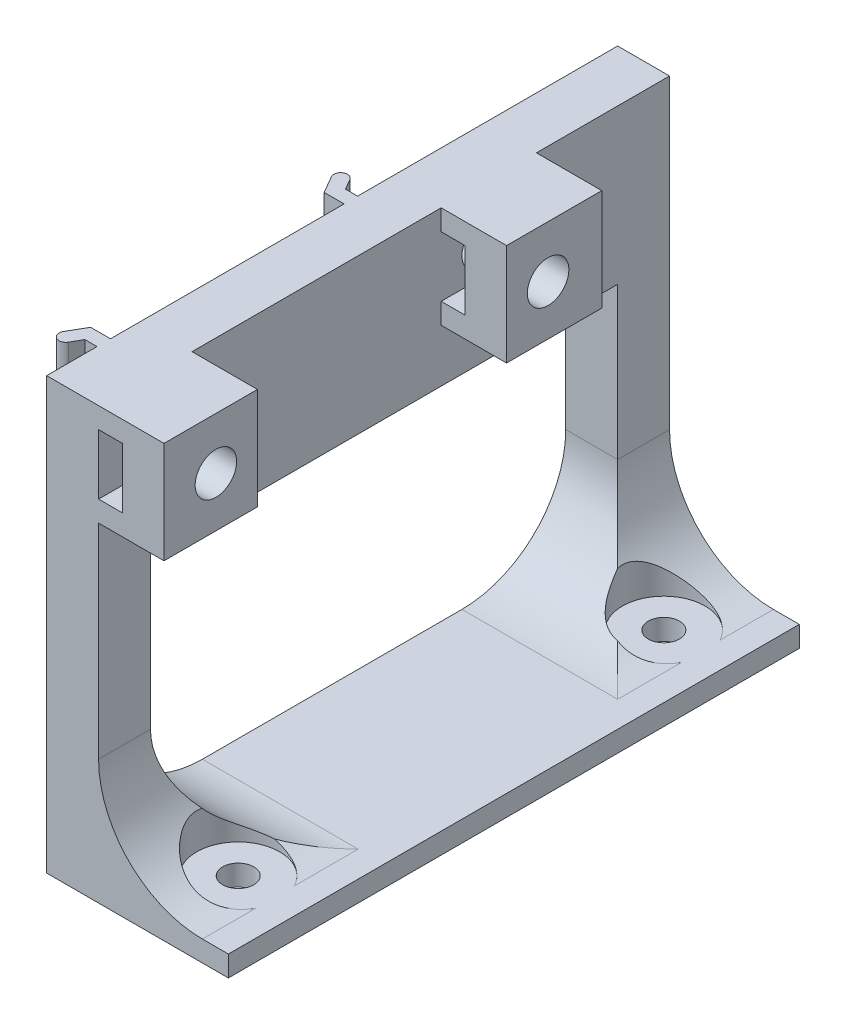
from build123d import *

# Parameters (mm, degrees)
SKETCH_1_W               = 17.5
SKETCH_1_H               = 55
EXTRUDE_1_DEPTH          = 2
SKETCH_2_W               = 5
SKETCH_2_H               = 5
EXTRUDE_2_DEPTH          = 33
EXTRUDE_3_DEPTH          = 6.5
EXTRUDE_3_DEPTH_BACK     = 8.378522314
SKETCH_3_W               = 5
SKETCH_3_H               = 55
SKETCH_4_R               = 1.5
CUT_EXTRUDE_1_DEPTH      = 10
FILLET_1_R               = 10
SKETCH_5_R               = 4
CUT_EXTRUDE_2_DEPTH      = 12
EXTRUDE_START            = -14.878522
EXTRUDE_4_DEPTH          = 14.878522
SKETCH_7_W               = 4
SKETCH_7_H               = 2
SKETCH_7_W_2             = 2.3
SKETCH_7_H_2             = 5.8
EXTRUDE_5_DEPTH          = 42.173435595
SKETCH_9_R               = 2
CUT_EXTRUDE_15_DEPTH     = 39
CUT_EXTRUDE_START        = -6.3
CUT_EXTRUDE_16_OUTLINE_W = 24
CUT_EXTRUDE_16_OUTLINE_H = 9.8
CUT_EXTRUDE_16_DEPTH     = 6.3


# Read off the part's stored shape, not the designer's step: Вырез-Вытянуть16
with BuildPart() as part:
    # Эскиз1 → Бобышка-Вытянуть1 (new body)
    with BuildSketch(Plane(origin=(0, 0, 0), x_dir=(1, 0, 0), z_dir=(0, 1, 0))):
        with Locations((8.75, 27.5)):
            Rectangle(SKETCH_1_W, SKETCH_1_H)
    extrude(amount=EXTRUDE_1_DEPTH)

    # Эскиз2 → Бобышка-Вытянуть2 (add)
    with BuildSketch(Plane(origin=(0, 2, 0), x_dir=(1, 0, 0), z_dir=(0, 1, 0))):
        with Locations((2.5, 52.5)):
            Rectangle(SKETCH_2_W, SKETCH_2_H)
        with Locations((2.5, 2.5)):
            Rectangle(SKETCH_2_W, SKETCH_2_H)
    extrude(amount=EXTRUDE_2_DEPTH)

    # Эскиз3 → Бобышка-Вытянуть3 (add, two sides: drawn at the far end of the back side and taken through both)
    with BuildSketch(Plane(origin=(0, 35, 0), x_dir=(1, 0, 0), z_dir=(0, 1, 0)).offset(-EXTRUDE_3_DEPTH_BACK)):
        with Locations((2.5, 27.5)):
            Rectangle(SKETCH_3_W, SKETCH_3_H)
    extrude(amount=EXTRUDE_3_DEPTH + EXTRUDE_3_DEPTH_BACK)

    # Эскиз4 → Вырез-Вытянуть1 (cut)
    with BuildSketch(Plane(origin=(0, 2, 0), x_dir=(1, 0, 0), z_dir=(0, 1, 0))):
        with Locations(Location((11.449842766, 48, 0), (0, 0, 270))):
            Circle(SKETCH_4_R)
        with Locations(Location((11.449842766, 7, 0), (0, 0, 270))):
            Circle(SKETCH_4_R)
    extrude(amount=-CUT_EXTRUDE_1_DEPTH, mode=Mode.SUBTRACT)

    # Скругление1
    # the kernel refuses this fillet: 10 mm, written as the material it adds along each edge
    with BuildSketch(Plane(origin=(5, 2, -50), x_dir=(0, 0, 1), z_dir=(-1, 0, 0)), Plane(origin=(5, 2, 0), x_dir=(0, 1, 0), z_dir=(0, 0, -1))) as fillet_1_piece_1:
        with BuildLine():
            CenterArc((FILLET_1_R, FILLET_1_R), FILLET_1_R, 180, 90)
            Line((0, FILLET_1_R), (0, 0))
            Line((0, 0), (FILLET_1_R, 0))
        make_face()
    extrude(amount=5)
    with BuildSketch(Plane(origin=(5, 2, -55), x_dir=(0, 1, 0), z_dir=(0, 0, 1)), Plane(origin=(5, 2, -5), x_dir=(0, 0, -1), z_dir=(-1, 0, 0))) as fillet_1_piece_2:
        with BuildLine():
            CenterArc((FILLET_1_R, -FILLET_1_R), FILLET_1_R, 90, 90)
            Line((0, -FILLET_1_R), (0, 0))
            Line((0, 0), (FILLET_1_R, 0))
        make_face()
    extrude(amount=5)
    with BuildSketch(Plane(origin=(5, 2, -55), x_dir=(0, 1, 0), z_dir=(0, 0, 1))) as fillet_1_piece_3a_section:
        with BuildLine():
            CenterArc((FILLET_1_R, -FILLET_1_R), FILLET_1_R, 90, 90)
            Line((0, -FILLET_1_R), (0, 0))
            Line((0, 0), (FILLET_1_R, 0))
        make_face()
    fillet_1_piece_3a = extrude(amount=30, mode=Mode.PRIVATE)
    fillet_1_piece_3a = split(fillet_1_piece_3a, bisect_by=Plane(origin=(7.224830191, 4.283537978, -50), z_dir=(0, 0, 1)), keep=Keep.TOP, mode=Mode.PRIVATE)
    fillet_1_piece_3a = fillet_1_piece_3a - Plane(origin=(11.449842766, 4.283537978, -48), x_dir=(0, 0, 1), z_dir=(0, 1, 0)) * Cylinder(1.5, 100, mode=Mode.PRIVATE)
    with BuildSketch(Plane(origin=(30, 2, -50), x_dir=(0, 0, 1), z_dir=(-1, 0, 0))) as fillet_1_piece_3b_section:
        with BuildLine():
            CenterArc((FILLET_1_R, FILLET_1_R), FILLET_1_R, 180, 90)
            Line((0, FILLET_1_R), (0, 0))
            Line((0, 0), (FILLET_1_R, 0))
        make_face()
    fillet_1_piece_3b = extrude(amount=30, mode=Mode.PRIVATE)
    fillet_1_piece_3b = split(fillet_1_piece_3b, bisect_by=Plane(origin=(5, 2.276950555, -42.605283247), z_dir=(1, 0, 0)), keep=Keep.TOP, mode=Mode.PRIVATE)
    fillet_1_piece_3b = split(fillet_1_piece_3b, bisect_by=Plane(origin=(17.5, 2.276950555, -42.605283247), z_dir=(-1, 0, 0)), keep=Keep.TOP, mode=Mode.PRIVATE)
    fillet_1_piece_3b = fillet_1_piece_3b - Plane(origin=(11.449842766, 2.276950555, -48), x_dir=(0, 0, 1), z_dir=(0, 1, 0)) * Cylinder(1.5, 100, mode=Mode.PRIVATE)
    fillet_1_piece_3 = fillet_1_piece_3a & fillet_1_piece_3b
    add(fillet_1_piece_3)
    with BuildSketch(Plane(origin=(5, 2, 0), x_dir=(0, 1, 0), z_dir=(0, 0, -1))) as fillet_1_piece_4a_section:
        with BuildLine():
            CenterArc((FILLET_1_R, FILLET_1_R), FILLET_1_R, 180, 90)
            Line((0, FILLET_1_R), (0, 0))
            Line((0, 0), (FILLET_1_R, 0))
        make_face()
    fillet_1_piece_4a = extrude(amount=30, mode=Mode.PRIVATE)
    fillet_1_piece_4a = split(fillet_1_piece_4a, bisect_by=Plane(origin=(7.224831151, 4.283537771, -5), z_dir=(0, 0, -1)), keep=Keep.TOP, mode=Mode.PRIVATE)
    fillet_1_piece_4a = fillet_1_piece_4a - Plane(origin=(11.449842766, 4.283537771, -7), x_dir=(0, 0, 1), z_dir=(0, 1, 0)) * Cylinder(1.5, 100, mode=Mode.PRIVATE)
    with BuildSketch(Plane(origin=(30, 2, -5), x_dir=(0, 0, -1), z_dir=(-1, 0, 0))) as fillet_1_piece_4b_section:
        with BuildLine():
            CenterArc((FILLET_1_R, -FILLET_1_R), FILLET_1_R, 90, 90)
            Line((0, -FILLET_1_R), (0, 0))
            Line((0, 0), (FILLET_1_R, 0))
        make_face()
    fillet_1_piece_4b = extrude(amount=30, mode=Mode.PRIVATE)
    fillet_1_piece_4b = split(fillet_1_piece_4b, bisect_by=Plane(origin=(5, 2.276949142, -12.394716375), z_dir=(1, 0, 0)), keep=Keep.TOP, mode=Mode.PRIVATE)
    fillet_1_piece_4b = split(fillet_1_piece_4b, bisect_by=Plane(origin=(17.5, 2.276949142, -12.394716375), z_dir=(-1, 0, 0)), keep=Keep.TOP, mode=Mode.PRIVATE)
    fillet_1_piece_4b = fillet_1_piece_4b - Plane(origin=(11.449842766, 2.276949142, -7), x_dir=(0, 0, 1), z_dir=(0, 1, 0)) * Cylinder(1.5, 100, mode=Mode.PRIVATE)
    fillet_1_piece_4 = fillet_1_piece_4a & fillet_1_piece_4b
    add(fillet_1_piece_4)

    # Эскиз5 → Вырез-Вытянуть2 (cut)
    with BuildSketch(Plane(origin=(0, 2, 0), x_dir=(1, 0, 0), z_dir=(0, 1, 0))):
        with Locations((11.449842766, 48)):
            Circle(SKETCH_5_R)
        with Locations((11.449842766, 7)):
            Circle(SKETCH_5_R)
    extrude(amount=CUT_EXTRUDE_2_DEPTH, mode=Mode.SUBTRACT)

    # Эскиз6 → Бобышка-Вытянуть4 (add)
    with BuildSketch(Plane(origin=(0, 41.5, 0), x_dir=(1, 0, 0), z_dir=(0, 1, 0)).offset(EXTRUDE_START)):
        with BuildLine():
            Line((0, 4.85), (0, 6.15))
            Line((0, 6.15), (-1.92, 6.15))
            Line((-1.92, 6.15), (-2.88, 4.487231225))
            ThreePointArc((-2.88, 4.487231225), (-2.642083488, 3.599314712), (-1.754166975, 3.837231225))
            Line((-1.754166975, 3.837231225), (-1.16944465, 4.85))
            Line((-1.16944465, 4.85), (0, 4.85))
        make_face()
        with BuildLine():
            Line((0, 28.65), (0, 29.95))
            Line((0, 29.95), (-1.16944465, 29.95))
            Line((-1.16944465, 29.95), (-1.754166975, 30.962768775))
            ThreePointArc((-1.754166975, 30.962768775), (-2.642083488, 31.200685288), (-2.88, 30.312768775))
            Line((-2.88, 30.312768775), (-1.92, 28.65))
            Line((-1.92, 28.65), (0, 28.65))
        make_face()
    extrude(amount=EXTRUDE_4_DEPTH)

    # Эскиз7 → Бобышка-Вытянуть5 (add)
    with BuildSketch(Plane.XY):
        with Locations((9.3, 40.5)):
            Rectangle(SKETCH_7_W, SKETCH_7_H)
        with Locations((6.15, 40.5)):
            Rectangle(SKETCH_7_W_2, SKETCH_7_H)
        with Locations((9.3, 36.6)):
            Rectangle(SKETCH_7_W, SKETCH_7_H_2)
        Polygon((7.3, 33.7), (5, 33.7), (5, 31.7), (11.3, 31.7), (11.3, 33.7), align=None)
    extrude(amount=-EXTRUDE_5_DEPTH)

    # Эскиз9 → Вырез-Вытянуть15 (cut)
    with BuildSketch(Plane(origin=(11.3, 0, 0), x_dir=(0, 0, -1), z_dir=(1, 0, 0))):
        with Locations((37, 36.5)):
            Circle(SKETCH_9_R)
        with Locations((5, 36.5)):
            Circle(SKETCH_9_R)
    extrude(amount=-CUT_EXTRUDE_15_DEPTH, mode=Mode.SUBTRACT)

    # Вырез-Вытянуть16 outline → Вырез-Вытянуть16 (cut)
    with BuildSketch(Plane(origin=(11.3, 0, 0), x_dir=(0, 0, -1), z_dir=(1, 0, 0)).offset(CUT_EXTRUDE_START)):
        with Locations((21, 36.6)):
            Rectangle(CUT_EXTRUDE_16_OUTLINE_W, CUT_EXTRUDE_16_OUTLINE_H)
    extrude(amount=CUT_EXTRUDE_16_DEPTH, mode=Mode.SUBTRACT)


solid = part.part
